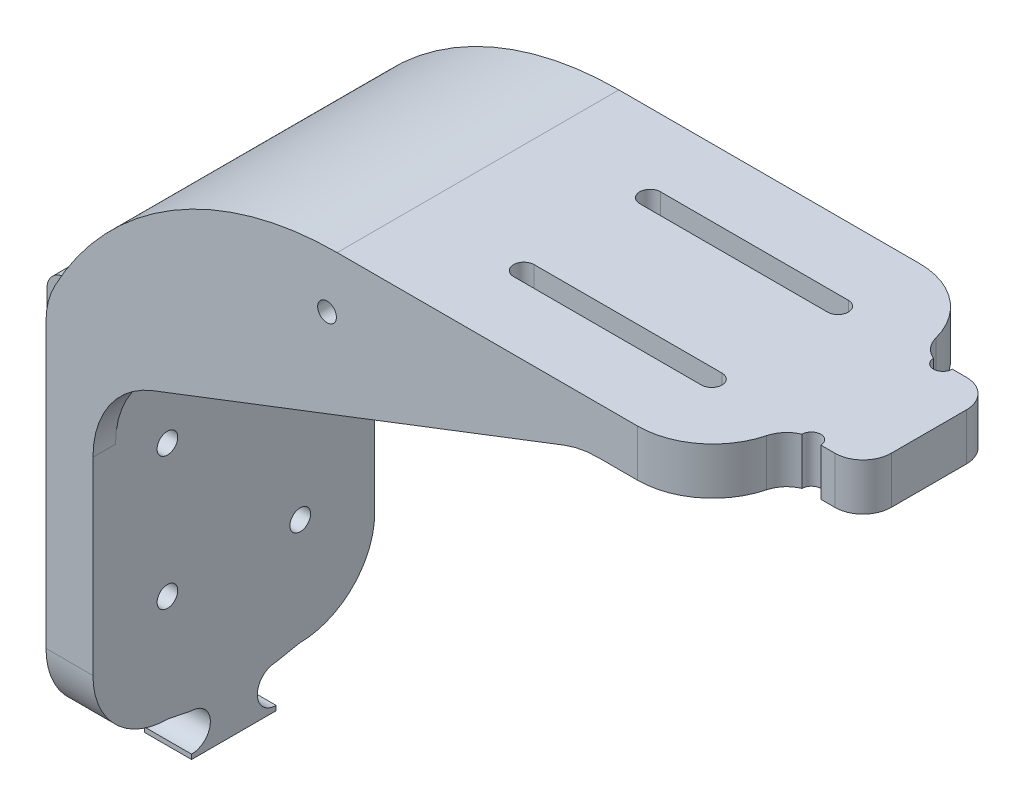
from build123d import *

# Parameters (mm, degrees)
SALIENTE_EXTRUIR1_DEPTH = 30
CORTAR_EXTRUIR1_DEPTH   = 5
CROQUIS3_W              = 30.2
CROQUIS3_H              = 25.2
CORTAR_EXTRUIR2_DEPTH   = 2
CROQUIS4_R              = 1.1
CORTAR_EXTRUIR3_DEPTH   = 5
CROQUIS5_W              = 25.2
CROQUIS5_H              = 25.2
CORTAR_EXTRUIR4_DEPTH   = 2
REDONDEO2_R             = 8
REDONDEO3_R             = 2.7
CROQUIS6_W              = 8
CROQUIS6_H              = 14
SALIENTE_EXTRUIR2_DEPTH = 5
REDONDEO4_R             = 3
SALIENTE_EXTRUIR4_START = -2.4
SALIENTE_EXTRUIR4_DEPTH = 2.4
SALIENTE_EXTRUIR5_START = -30
SALIENTE_EXTRUIR5_DEPTH = 2.4
REDONDEO5_R             = 10
SALIENTE_EXTRUIR6_START = -5
SALIENTE_EXTRUIR6_DEPTH = 5
CORTAR_EXTRUIR6_START   = -2.4
CROQUIS14_R             = 1
CORTAR_EXTRUIR6_DEPTH   = 30
CROQUIS18_W             = 3
CROQUIS18_H             = 7.151114147
SALIENTE_EXTRUIR7_DEPTH = 5
CORTAR_EXTRUIR7_START   = -3
CORTAR_EXTRUIR7_DEPTH   = 3
CROQUIS22_R             = 1
CORTAR_EXTRUIR8_DEPTH   = 5
REDONDEO8_R             = 2
REDONDEO6_R             = 3


with BuildPart() as part:
    # Croquis1 → Saliente-Extruir1 (new body)
    with BuildSketch(Plane.XY):
        with BuildLine():
            Line((0, 0), (0, 5))
            Line((0, 5), (-40, 5))
            ThreePointArc((-40, 5), (-58.443639467, -0.437358826), (-71, -15))
            Line((-71, -15), (-71, -55))
            Line((-71, -55), (-66, -55))
            Line((-66, -55), (-66, -16.078431373))
            ThreePointArc((-66, -16.078431373), (-55.744135615, -4.621589797), (-41.078431373, 0))
            Line((-41.078431373, 0), (0, 0))
        make_face()
    extrude(amount=SALIENTE_EXTRUIR1_DEPTH)

    # Croquis2 → Cortar-Extruir1 (cut)
    with BuildSketch(Plane(origin=(0, 5, 0), x_dir=(1, 0, 0), z_dir=(0, 1, 0))):
        with BuildLine():
            Line((-18.4, -7.18), (-8.4, -7.18))
            ThreePointArc((-8.4, -7.18), (-7.3, -8.28), (-8.4, -9.38))
            Line((-8.4, -9.38), (-28.4, -9.38))
            ThreePointArc((-28.4, -9.38), (-29.5, -8.28), (-28.4, -7.18))
            Line((-28.4, -7.18), (-18.4, -7.18))
        make_face()
        with BuildLine():
            Line((-8.4, -20.62), (-28.4, -20.62))
            ThreePointArc((-28.4, -20.62), (-29.5, -21.72), (-28.4, -22.82))
            Line((-28.4, -22.82), (-18.4, -22.82))
            Line((-18.4, -22.82), (-8.4, -22.82))
            ThreePointArc((-8.4, -22.82), (-7.3, -21.72), (-8.4, -20.62))
        make_face()
    extrude(amount=-CORTAR_EXTRUIR1_DEPTH, mode=Mode.SUBTRACT)

    # Croquis3 → Cortar-Extruir2 (cut)
    with BuildSketch(Plane.XZ):
        with Locations((-18.4, 15)):
            Rectangle(CROQUIS3_W, CROQUIS3_H)
    extrude(amount=-CORTAR_EXTRUIR2_DEPTH, mode=Mode.SUBTRACT)

    # Croquis4 → Cortar-Extruir3 (cut)
    with BuildSketch(Plane.ZY.offset(71)):
        with Locations((22.071067812, -29.528932188)):
            Circle(CROQUIS4_R)
        with Locations((22.071067812, -43.671067812)):
            Circle(CROQUIS4_R)
        with Locations((7.928932188, -43.671067812)):
            Circle(CROQUIS4_R)
        with Locations((7.928932188, -29.528932188)):
            Circle(CROQUIS4_R)
    extrude(amount=-CORTAR_EXTRUIR3_DEPTH, mode=Mode.SUBTRACT)

    # Croquis5 → Cortar-Extruir4 (cut)
    with BuildSketch(Plane.ZY.offset(71)):
        with Locations((15, -36.6)):
            Rectangle(CROQUIS5_W, CROQUIS5_H)
    extrude(amount=-CORTAR_EXTRUIR4_DEPTH, mode=Mode.SUBTRACT)

    # Redondeo2
    redondeo2_edges = [part.edges().sort_by_distance(p)[0] for p in [
        (0, 2.5, 0),
        (-71, -15, 15),
        (-68.5, -55, 30),
        (0, 2.5, 30),
        (-68.5, -55, 0),
    ]]
    fillet(redondeo2_edges, radius=REDONDEO2_R)

    # Redondeo3
    redondeo3_edges = [part.edges().sort_by_distance(p)[0] for p in [
        (-70, -24, 27.6),
        (-70, -49.2, 27.6),
        (-70, -49.2, 2.4),
        (-70, -24, 2.4),
        (-3.3, 1, 27.6),
        (-3.3, 1, 2.4),
        (-33.5, 1, 2.4),
        (-33.5, 1, 27.6),
    ]]
    fillet(redondeo3_edges, radius=REDONDEO3_R)

    # Croquis6 → Saliente-Extruir2 (add)
    with BuildSketch(Plane.XZ):
        with Locations((4, 15)):
            Rectangle(CROQUIS6_W, CROQUIS6_H)
    extrude(amount=-SALIENTE_EXTRUIR2_DEPTH)

    # Redondeo4
    redondeo4_edges = [part.edges().sort_by_distance(p)[0] for p in [
        (8, 2.5, 8),
        (8, 2.5, 22),
    ]]
    fillet(redondeo4_edges, radius=REDONDEO4_R)

    # Croquis11 → Saliente-Extruir4 (add)
    with BuildSketch(Plane.XY.offset(30).offset(SALIENTE_EXTRUIR4_START)):
        with BuildLine():
            Line((-41.078431373, 0), (-14.078431373, 0))
            Line((-14.078431373, 0), (-66, -20))
            Line((-66, -20), (-66, -16.078431373))
            ThreePointArc((-66, -16.078431373), (-55.744135615, -4.621589797), (-41.078431373, 0))
        make_face()
    extrude(amount=SALIENTE_EXTRUIR4_DEPTH)

    # Croquis11<2> → Saliente-Extruir5 (add)
    with BuildSketch(Plane.XY.offset(30).offset(SALIENTE_EXTRUIR5_START)):
        with BuildLine():
            Line((-41.078431373, 0), (-14.078431373, 0))
            Line((-14.078431373, 0), (-66, -20))
            Line((-66, -20), (-66, -16.078431373))
            ThreePointArc((-66, -16.078431373), (-55.744135615, -4.621589797), (-41.078431373, 0))
        make_face()
    extrude(amount=SALIENTE_EXTRUIR5_DEPTH)

    # Redondeo5
    redondeo5_edges = [part.edges().sort_by_distance(p)[0] for p in [
        (-14.078431373, 0, 28.8),
        (-66, -20, 28.8),
        (-66, -20, 1.2),
        (-14.078431373, 0, 1.2),
    ]]
    fillet(redondeo5_edges, radius=REDONDEO5_R)

    # Croquis12 → Saliente-Extruir6 (add)
    with BuildSketch(Plane.ZY.offset(71).offset(SALIENTE_EXTRUIR6_START)):
        with BuildLine():
            Line((10.5, -55), (19.5, -55))
            Line((19.5, -55), (22, -55))
            Line((22, -55), (19.5, -55.5))
            ThreePointArc((19.5, -55.5), (17.5, -57.5), (19.5, -59.5))
            Line((19.5, -59.5), (19.5, -60))
            Line((19.5, -60), (10.5, -60))
            Line((10.5, -60), (10.5, -59.5))
            ThreePointArc((10.5, -59.5), (12.5, -57.5), (10.5, -55.5))
            Line((10.5, -55.5), (8, -55))
            Line((8, -55), (10.5, -55))
        make_face()
    extrude(amount=SALIENTE_EXTRUIR6_DEPTH)

    # Croquis14 → Cortar-Extruir6 (cut)
    with BuildSketch(Plane.XY.offset(2.4).offset(CORTAR_EXTRUIR6_START)):
        with Locations((-41.078431373, -1.005)):
            Circle(CROQUIS14_R)
    extrude(amount=CORTAR_EXTRUIR6_DEPTH, mode=Mode.SUBTRACT)

    # Croquis18 → Saliente-Extruir7 (add)
    with BuildSketch(Plane.ZY.offset(71)):
        with Locations((23.4, -20.424442926)):
            Rectangle(CROQUIS18_W, CROQUIS18_H)
    extrude(amount=SALIENTE_EXTRUIR7_DEPTH)

    # Croquis19 → Cortar-Extruir7 (cut)
    with BuildSketch(Plane.XY.offset(24.9).offset(CORTAR_EXTRUIR7_START)):
        with BuildLine():
            Line((-72.625, -22.049442927), (-72.625, -24))
            Line((-72.625, -24), (-71, -24))
            Line((-71, -24), (-71, -20.424442927))
            ThreePointArc((-71, -20.424442927), (-73.774048519, -19.275394407), (-72.625, -22.049442927))
        make_face()
    extrude(amount=CORTAR_EXTRUIR7_DEPTH, mode=Mode.SUBTRACT)

    # Croquis22 → Cortar-Extruir8 (cut)
    with BuildSketch(Plane.XZ):
        with Locations((2.5, 22)):
            Circle(CROQUIS22_R)
        with Locations((2.5, 8)):
            Circle(CROQUIS22_R)
    extrude(amount=-CORTAR_EXTRUIR8_DEPTH, mode=Mode.SUBTRACT)

    # Redondeo8
    redondeo8_edges = [part.edges().sort_by_distance(p)[0] for p in [
        (-76, -16.848885853, 23.4),
        (-76, -24, 23.4),
    ]]
    fillet(redondeo8_edges, radius=REDONDEO8_R)

    # Cortar-Barrer1: sweep along a path in Croquis23
    with BuildLine(Plane.XY.offset(2.4)) as cortar_barrer1_path:
        Line((-33.5, 0), (-41.078431373, 0))
        ThreePointArc((-41.078431373, 0), (-46.058616362, -0.620868951), (-50.857769, -2.089151876))
    # Croquis24 → Cortar-Barrer1 (sweep, cut)
    with BuildSketch(Plane(origin=(-33.5, 0, 0), x_dir=(0, 0, -1), z_dir=(1, 0, 0))):
        with BuildLine():
            Line((-7, 0), (-23, 0))
            ThreePointArc((-23, 0), (-15, 1), (-7, 0))
        make_face()
    sweep(path=cortar_barrer1_path.line, transition=Transition.RIGHT, mode=Mode.SUBTRACT)

    # Redondeo6
    # the kernel refuses this fillet: 3 mm, written as the material it adds along each edge
    with BuildSketch(Plane(origin=(0, 0, 8), x_dir=(-0.1270760613131033, 0, -0.9918929753966144), z_dir=(0, 1, 0))) as redondeo6_piece_1:
        with BuildLine():
            CenterArc((2.414445165, -2.975678926), REDONDEO6_R, 97.300661555, 52.967156255)
            Line((-0.190614092, -1.487839463), (-0.242715277, -1.458082674))
            ThreePointArc((-0.242715277, -1.458082674), (-0.154820625, -0.736295168), (-0.059513579, 0.007624564))
            Line((-0.059513579, 0.007624564), (0.007624564, 0.059513579))
            ThreePointArc((0.007624564, 0.059513579), (1.016608491, -0.004856197), (2.025592417, 0.059513579))
            Line((2.025592417, 0.059513579), (2.033216981, 0))
        make_face()
    extrude(amount=5)
    with BuildSketch(Plane(origin=(0, 0, 22), x_dir=(-0.12707606131310373, 0, 0.9918929753966141), z_dir=(0, 1, 0))) as redondeo6_piece_2:
        with BuildLine():
            CenterArc((2.414445165, 2.975678926), REDONDEO6_R, 209.73218219, 52.967156255)
            Line((-0.190614092, 1.487839463), (-0.242715277, 1.458082674))
            ThreePointArc((-0.242715277, 1.458082674), (-0.154820625, 0.736295168), (-0.059513579, -0.007624564))
            Line((-0.059513579, -0.007624564), (0.007624564, -0.059513579))
            ThreePointArc((0.007624564, -0.059513579), (1.016608491, 0.004856197), (2.025592417, -0.059513579))
            Line((2.025592417, -0.059513579), (2.033216981, 0))
        make_face()
    extrude(amount=5)


solid = part.part
